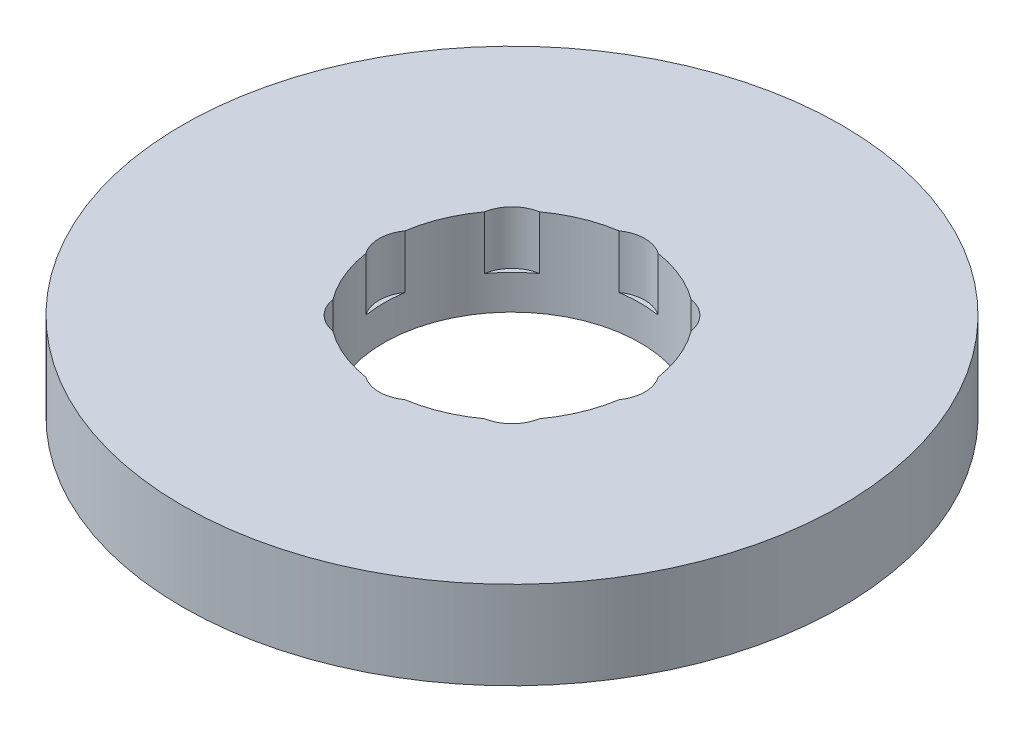
from build123d import *

# Parameters (mm, degrees)
SKETCH1_R           = 45
BOSS_EXTRUDE1_DEPTH = 12
SKETCH2_R           = 17.5
CUT_EXTRUDE1_DEPTH  = 65.761099435
SKETCH3_R           = 4.584760577
CUT_EXTRUDE2_DEPTH  = 7.291230431
CIRPATTERN1_COUNT   = 8


with BuildPart() as part:
    # Sketch1 → Boss-Extrude1 (new body)
    with BuildSketch(Plane(origin=(0, 0, 0), x_dir=(1, 0, 0), z_dir=(0, 1, 0))):
        Circle(SKETCH1_R)
    extrude(amount=BOSS_EXTRUDE1_DEPTH)

    # Sketch2 → Cut-Extrude1 (cut, through all)
    with BuildSketch(Plane(origin=(0, 0, 0), x_dir=(1, 0, 0), z_dir=(0, 1, 0))):
        Circle(SKETCH2_R)
    extrude(amount=CUT_EXTRUDE1_DEPTH, mode=Mode.SUBTRACT)

    # Sketch3 → Cut-Extrude2 (cut)
    with BuildSketch(Plane(origin=(0, 12, 0), x_dir=(1, 0, 0), z_dir=(0, 1, 0))):
        with Locations((-13.559354716, 0)):
            Circle(SKETCH3_R)
    cut_extrude2 = extrude(amount=-CUT_EXTRUDE2_DEPTH, mode=Mode.SUBTRACT)

    # CirPattern1: Cut-Extrude2 ×8 about axis
    cirpattern1_axis = Axis((0, 0, 0), (0, 1, 0))
    for i in range(1, CIRPATTERN1_COUNT):
        add(cut_extrude2.rotate(cirpattern1_axis, i * 360 / CIRPATTERN1_COUNT), mode=Mode.SUBTRACT)


solid = part.part
